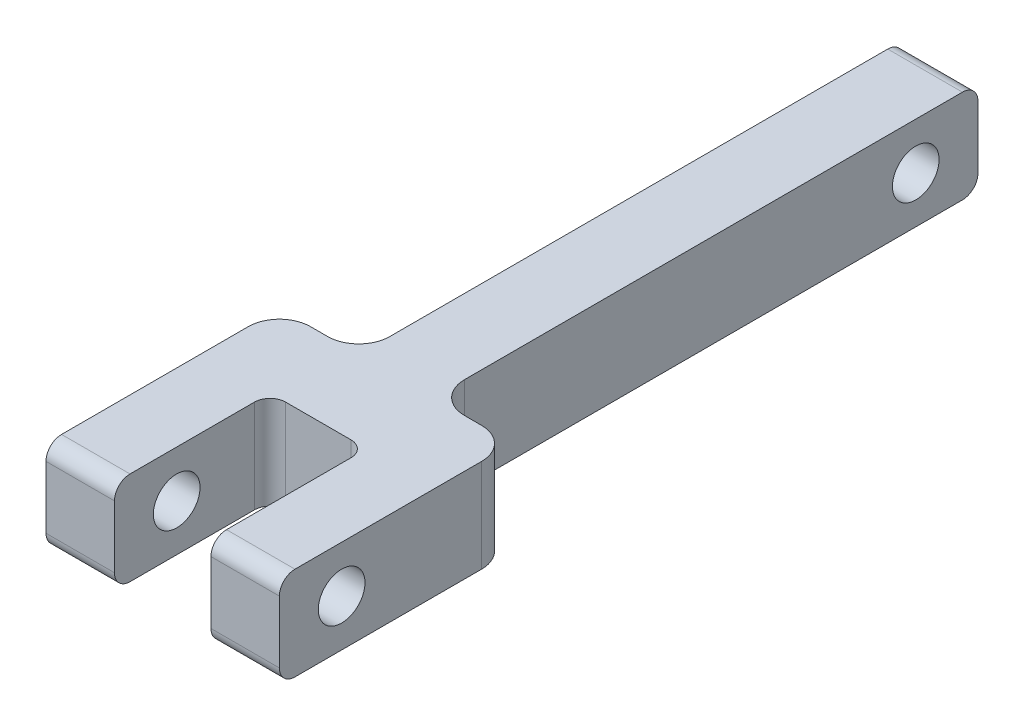
from build123d import *
from build123d.topology import SkipClean

# Parameters (mm, degrees)
SALIENTE_EXTRUIR1_DEPTH    = 2.4
CORTAR_EXTRUIR1_DEPTH      = 26.29347742
CORTAR_EXTRUIR1_DEPTH_BACK = 26.29347742
CROQUIS2_R                 = 1.5
CROQUIS3_R                 = 1.5
SALIENTE_EXTRUIR2_DEPTH    = 7.5
CORTAR_EXTRUIR2_DEPTH      = 3.1
REDONDEO1_R                = 2
REDONDEO2_R                = 1


with BuildPart() as part:
    # Croquis1 → Saliente-Extruir1 (new, symmetric)
    with BuildSketch(Plane(origin=(0, 0, 0), x_dir=(0, 0, -1), z_dir=(1, 0, 0))):
        with BuildLine():
            Line((-24, 3), (24, 3))
            ThreePointArc((24, 3), (24.707106781, 2.707106781), (25, 2))
            Line((25, 2), (25, -2))
            ThreePointArc((25, -2), (24.707106781, -2.707106781), (24, -3))
            Line((24, -3), (-24, -3))
            ThreePointArc((-24, -3), (-24.707106781, -2.707106781), (-25, -2))
            Line((-25, -2), (-25, 2))
            ThreePointArc((-25, 2), (-24.707106781, 2.707106781), (-24, 3))
        make_face()
    extrude(amount=SALIENTE_EXTRUIR1_DEPTH, both=True)

    # Croquis2 → Cortar-Extruir1 (cut, two sides: drawn at the far end of the back side and taken through both)
    with BuildSketch(Plane(origin=(0, 0, 0), x_dir=(0, 0, -1), z_dir=(1, 0, 0)).offset(-CORTAR_EXTRUIR1_DEPTH_BACK)):
        with Locations((-21, 0)):
            Circle(CROQUIS2_R)
        with Locations((21, 0)):
            Circle(CROQUIS2_R)
    extrude(amount=CORTAR_EXTRUIR1_DEPTH + CORTAR_EXTRUIR1_DEPTH_BACK, mode=Mode.SUBTRACT)

    # Croquis3 → Saliente-Extruir2 (add, symmetric)
    with SkipClean():  # the faces are left unmerged after this step: merging them gives an invalid solid
        with BuildSketch(Plane(origin=(0, 0, 0), x_dir=(0, 0, -1), z_dir=(1, 0, 0))):
            with BuildLine():
                Line((-25, 2), (-25, -2))
                ThreePointArc((-25, -2), (-24.707106781, -2.707106781), (-24, -3))
                Line((-24, -3), (-10, -3))
                Line((-10, -3), (-10, 3))
                Line((-10, 3), (-24, 3))
                ThreePointArc((-24, 3), (-24.707106781, 2.707106781), (-25, 2))
            make_face()
            with Locations((-21, 0)):
                Circle(CROQUIS3_R, mode=Mode.SUBTRACT)
        extrude(amount=SALIENTE_EXTRUIR2_DEPTH, both=True)
    add(part.part.scale(1), mode=Mode.REPLACE)  # the faces are merged on a copy

    # Croquis4 → Cortar-Extruir2 (cut, symmetric)
    with BuildSketch(Plane(origin=(0, 0, 0), x_dir=(0, 0, -1), z_dir=(1, 0, 0))):
        with BuildLine():
            Line((-24, 3), (-15, 3))
            Line((-15, 3), (-15, -3))
            Line((-15, -3), (-24, -3))
            ThreePointArc((-24, -3), (-24.707106781, -2.707106781), (-25, -2))
            Line((-25, -2), (-25, 2))
            ThreePointArc((-25, 2), (-24.707106781, 2.707106781), (-24, 3))
        make_face()
    extrude(amount=CORTAR_EXTRUIR2_DEPTH, both=True, mode=Mode.SUBTRACT)

    # Redondeo1
    redondeo1_edges = [part.edges().sort_by_distance(p)[0] for p in [
        (2.4, 0, 10),
        (-2.4, 0, 10),
        (7.5, 0, 10),
        (-7.5, 0, 10),
    ]]
    fillet(redondeo1_edges, radius=REDONDEO1_R)

    # Redondeo2
    redondeo2_edges = [part.edges().sort_by_distance(p)[0] for p in [
        (3.1, 0, 15),
        (-3.1, 0, 15),
    ]]
    fillet(redondeo2_edges, radius=REDONDEO2_R)


solid = part.part
